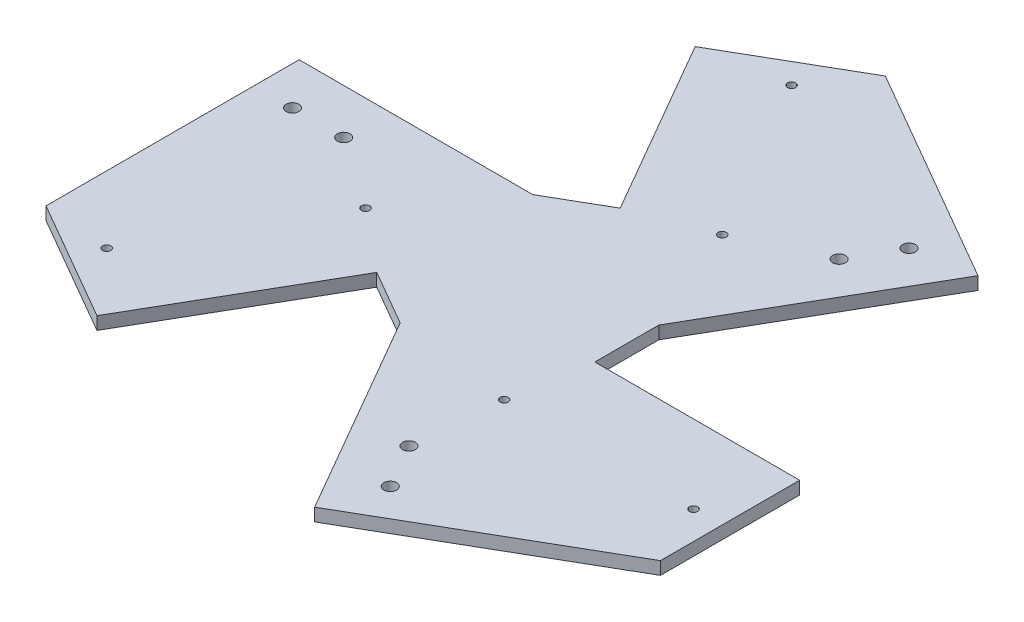
from build123d import *

# Parameters (mm, degrees)
SKETCH1_R           = 1.016
SKETCH1_R_2         = 1.5875
BOSS_EXTRUDE2_DEPTH = 3.175


with BuildPart() as part:
    # Sketch1 → Boss-Extrude2 (new body)
    with BuildSketch(Plane(origin=(0, 0, 0), x_dir=(1, 0, 0), z_dir=(0, 1, 0))):
        Polygon((76.2, -43.994090512), (21.827126964, -75.386283396), (-7.145746073, -25.203795256), (-20.893899358, -17.266295256), (-46.293899358, -61.260385768), (-76.2, -43.994090512), (-76.2, 18.790295256), (-18.254253927, 18.790295256), (-4.506100642, 26.727795256), (-29.906100642, 70.721885768), (0, 87.988181024), (54.372873036, 56.59598814), (25.4, 6.4135), (25.4, -9.4615), (76.2, -9.4615), align=None)
        with Locations((69.2404, -28.829)):
            Circle(SKETCH1_R, mode=Mode.SUBTRACT)
        with Locations((-59.586846366, -45.549445368)):
            Circle(SKETCH1_R, mode=Mode.SUBTRACT)
        with Locations((-9.653553634, 74.378445368)):
            Circle(SKETCH1_R, mode=Mode.SUBTRACT)
        with Locations((22.2504, -28.829)):
            Circle(SKETCH1_R, mode=Mode.SUBTRACT)
        with Locations((-36.091846366, -4.854911644)):
            Circle(SKETCH1_R, mode=Mode.SUBTRACT)
        with Locations((13.841446366, 33.683911644)):
            Circle(SKETCH1_R, mode=Mode.SUBTRACT)
        with Locations((26.738386423, -61.552243797)):
            Circle(SKETCH1_R_2, mode=Mode.SUBTRACT)
        with Locations((20.388386423, -50.553721169)):
            Circle(SKETCH1_R_2, mode=Mode.SUBTRACT)
        with Locations((-53.975, 7.62)):
            Circle(SKETCH1_R_2, mode=Mode.SUBTRACT)
        with Locations((-66.675, 7.62)):
            Circle(SKETCH1_R_2, mode=Mode.SUBTRACT)
        with Locations((33.586613577, 42.933721169)):
            Circle(SKETCH1_R_2, mode=Mode.SUBTRACT)
        with Locations((39.936613577, 53.932243797)):
            Circle(SKETCH1_R_2, mode=Mode.SUBTRACT)
    extrude(amount=BOSS_EXTRUDE2_DEPTH)


solid = part.part
